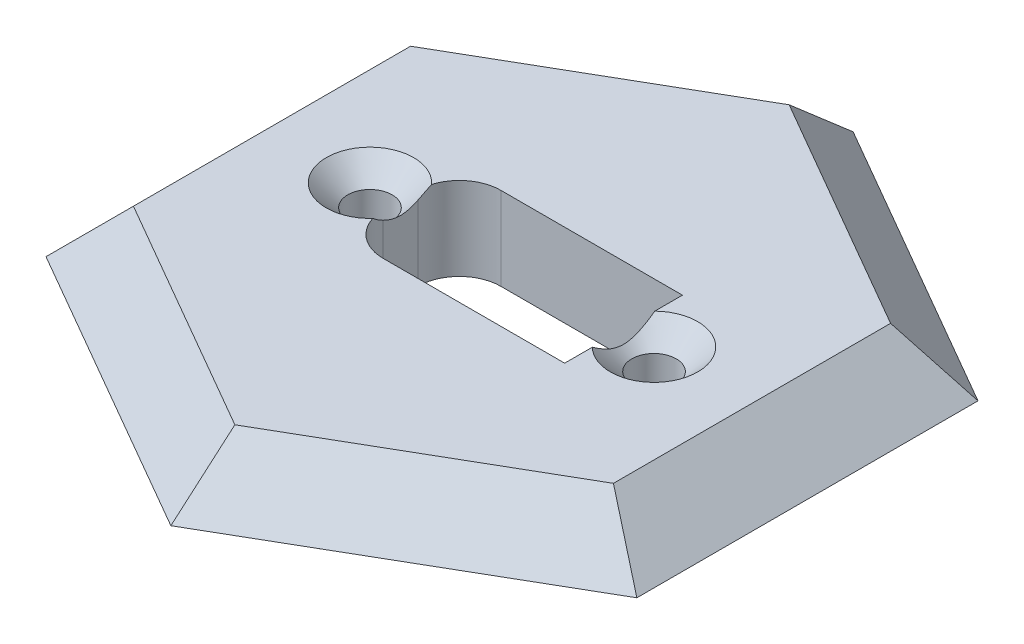
from build123d import *

# Parameters (mm, degrees)
SKETCH1_R                                           = 26
BOSS_EXTRUDE1_DEPTH                                 = 4
SKETCH3_R                                           = 17
BOSS_EXTRUDE2_DEPTH                                 = 2
CUT_EXTRUDE1_DEPTH                                  = 20
SKETCH4_R                                           = 1.6
CUT_EXTRUDE2_DEPTH                                  = 10
SKETCH6_OUTSIDE_W                                   = 88.756
SKETCH6_OUTSIDE_H                                   = 88.756
CUT_EXTRUDE3_DEPTH                                  = 10
CUT_EXTRUDE3_DRAFT                                  = -45
CSK_FOR_M3_COUNTERSUNK_FLAT_HEAD_SCREW2_D           = 3.2
CSK_FOR_M3_COUNTERSUNK_FLAT_HEAD_SCREW2_CSINK_D     = 6.3
CSK_FOR_M3_COUNTERSUNK_FLAT_HEAD_SCREW2_CSINK_ANGLE = 90


with BuildPart() as part:
    # Sketch1 → Boss-Extrude1 (new body)
    with BuildSketch(Plane(origin=(0, 0, 0), x_dir=(1, 0, 0), z_dir=(0, 1, 0))):
        Circle(SKETCH1_R)
    extrude(amount=BOSS_EXTRUDE1_DEPTH)

    # Sketch3 → Boss-Extrude2 (add)
    with BuildSketch(Plane.XZ):
        Circle(SKETCH3_R)
    extrude(amount=BOSS_EXTRUDE2_DEPTH)

    # Sketch2 → Cut-Extrude1 (cut)
    with BuildSketch(Plane(origin=(0, 4, 0), x_dir=(1, 0, 0), z_dir=(0, 1, 0))):
        with BuildLine():
            Line((-5.05, -4.25), (8.05, -4.25))
            Line((8.05, -4.25), (8.05, 4.25))
            Line((8.05, 4.25), (-5.05, 4.25))
            ThreePointArc((-5.05, 4.25), (-7.171320344, 3.371320344), (-8.05, 1.25))
            Line((-8.05, 1.25), (-8.05, -1.25))
            ThreePointArc((-8.05, -1.25), (-7.171320344, -3.371320344), (-5.05, -4.25))
        make_face()
    extrude(amount=-CUT_EXTRUDE1_DEPTH, mode=Mode.SUBTRACT)

    # Sketch4 → Cut-Extrude2 (cut)
    with BuildSketch(Plane(origin=(0, 4, 0), x_dir=(1, 0, 0), z_dir=(0, 1, 0))):
        with Locations((-10.25, 0)):
            Circle(SKETCH4_R)
        with Locations((10.25, 0)):
            Circle(SKETCH4_R)
    extrude(amount=-CUT_EXTRUDE2_DEPTH, mode=Mode.SUBTRACT)


with BuildPart() as cut_extrude3_tool:
    # Sketch6 outside → Cut-Extrude3 (with draft: the straight prism first)
    with BuildSketch(Plane(origin=(0, 4, 0), x_dir=(1, 0, 0), z_dir=(0, 1, 0))):
        Rectangle(SKETCH6_OUTSIDE_W, SKETCH6_OUTSIDE_H)
        Polygon((0, 20), (-17.320508076, 10), (-17.320508076, -10), (0, -20), (17.320508076, -10), (17.320508076, 10), align=None, mode=Mode.SUBTRACT)
    extrude(amount=-CUT_EXTRUDE3_DEPTH)
    # Cut-Extrude3: the draft: its side faces are tilted about the plane it starts from
    cut_extrude3_sides = [cut_extrude3_tool.faces().sort_by_distance(p)[0] for p in [
        (0, -1, 44.378),
        (44.378, -1, 0),
        (0, -1, -44.378),
        (-44.378, -1, 0),
        (8.660254038, -1, -15),
        (17.320508076, -1, 0),
        (8.660254038, -1, 15),
        (-8.660254038, -1, 15),
        (-17.320508076, -1, 0),
        (-8.660254038, -1, -15),
    ]]
    draft(cut_extrude3_sides, Plane(origin=(0, 4, 0), x_dir=(1, 0, 0), z_dir=(0, 1, 0)), CUT_EXTRUDE3_DRAFT)


with BuildPart() as part_1:
    add(part.part)

    # Cut-Extrude3: cut by cut_extrude3_tool
    add(cut_extrude3_tool.part, mode=Mode.SUBTRACT)

    # CSK for M3 Countersunk Flat Head Screw2 (through all)
    with Locations(Plane(origin=(0, 4, 0), x_dir=(1, 0, 0), z_dir=(0, 1, 0))):
        with Locations((-10.25, 0), (10.25, 0)):
            CounterSinkHole(CSK_FOR_M3_COUNTERSUNK_FLAT_HEAD_SCREW2_D / 2, CSK_FOR_M3_COUNTERSUNK_FLAT_HEAD_SCREW2_CSINK_D / 2, counter_sink_angle=CSK_FOR_M3_COUNTERSUNK_FLAT_HEAD_SCREW2_CSINK_ANGLE)


solid = part_1.part
